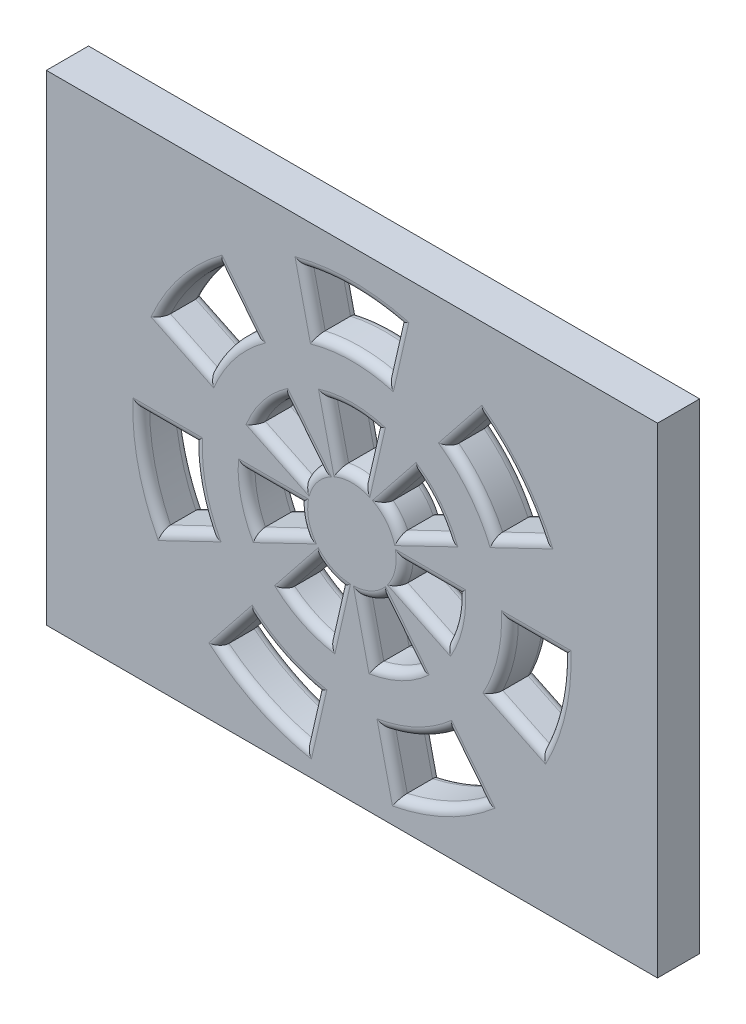
from build123d import *

# Parameters (mm, degrees)
BOSS_EXTRUDE1_DEPTH             = 2
BOSS_EXTRUDE2_DEPTH             = 38
SKETCH3_W                       = 1.9999999999999982
SKETCH3_H                       = 2
BOSS_EXTRUDE3_DEPTH             = 38
BOSS_EXTRUDE4_DEPTH             = 151
SKETCH6_W                       = 35.000000000000014
SKETCH6_H                       = 2.200000000000003
CUT_EXTRUDE1_DEPTH              = 160.34004518638747
SKETCH7_W                       = 35.00000000000001
SKETCH7_H                       = 2.200000000000003
CUT_EXTRUDE2_DEPTH              = 89.49011244201242
SKETCH5_W                       = 31.00000000000001
SKETCH5_H                       = 2
BOSS_EXTRUDE5_DEPTH             = 2
BOSS_EXTRUDE6_REACH             = 91.367
BOSS_EXTRUDE6_DIRECTION_2_REACH = 91.367
SKETCH10_W                      = 2
SKETCH10_H                      = 2.200000000000003
SKETCH10_W_2                    = 2.200000000000003
SKETCH10_H_2                    = 2
BOSS_EXTRUDE8_DEPTH             = 2
SKETCH11_W                      = 2
SKETCH11_H                      = 2.200000000000003
SKETCH11_W_2                    = 2.200000000000003
SKETCH11_H_2                    = 2
BOSS_EXTRUDE9_DEPTH             = 2
FILLET2_R                       = 2.5
SKETCH14_W                      = 36.5
SKETCH14_H                      = 7.750000000000002
BOSS_EXTRUDE10_DEPTH            = 2
SKETCH13_W                      = 31.000000000000007
SKETCH13_H                      = 3.000000000000001
CUT_EXTRUDE4_DEPTH              = 2
FILLET3_R                       = 2
FILLET4_R                       = 0.5
SKETCH15_R                      = 5.1000000000000005
CUT_EXTRUDE5_DEPTH              = 90.36721994109473
SKETCH16_R                      = 7.1000000000000005
BOSS_EXTRUDE11_DEPTH            = 1
FILLET5_R                       = 0.5
CUT_EXTRUDE3_DEPTH              = 160.34004518638747
FILLET6_R                       = 0.4
FILLET7_R                       = 0.5
CUT_EXTRUDE6_DEPTH              = 6
CUT_EXTRUDE8_DEPTH              = 90.367220028037
CUT_EXTRUDE11_DEPTH             = 90.367220028037
CUT_EXTRUDE11_DEPTH_BACK        = 90.367220028037
CUT_EXTRUDE12_DEPTH             = 43.59401366860162
CUT_EXTRUDE12_DEPTH_BACK        = 43.59401366860162
SKETCH21_W                      = 29
SKETCH21_H                      = 8.200000000000024


with BuildPart() as part:
    # Sketch1 → Boss-Extrude1 (new body)
    with BuildSketch(Plane(origin=(0, 0, 0), x_dir=(1, 0, 0), z_dir=(0, 1, 0))):
        Polygon((-19.500000000000007, 77.5), (19.499999999999993, 77.5), (19.50000000000001, -77.5), (-19.499999999999986, -77.5), align=None)
    extrude(amount=BOSS_EXTRUDE1_DEPTH)

    # Sketch2 → Boss-Extrude2 (add)
    with BuildSketch(Plane(origin=(0, 2, 0), x_dir=(1, 0, 0), z_dir=(0, 1, 0))):
        Polygon((-17.500000000000007, -77.5), (-17.500000000000007, -75.49999999999996), (-17.500000000000007, 75.5), (17.5, 75.5), (17.5, -75.49999999999994), (17.5, -77.5), (19.500000000000007, -77.5), (19.49999999999999, 77.5), (-19.500000000000007, 77.5), (-19.500000000000007, -77.5), align=None)
    extrude(amount=BOSS_EXTRUDE2_DEPTH)

    # Sketch3 → Boss-Extrude3 (add)
    with BuildSketch(Plane(origin=(0, 2, 0), x_dir=(1, 0, 0), z_dir=(0, 1, 0))):
        with Locations((-16.500000000000007, -76.5)):
            Rectangle(SKETCH3_W, SKETCH3_H)
        with Locations((-16.500000000000007, -72.3)):
            Rectangle(SKETCH3_W, SKETCH3_H)
        with Locations((16.5, -76.5)):
            Rectangle(SKETCH3_W, SKETCH3_H)
        with Locations((16.5, -72.3)):
            Rectangle(SKETCH3_W, SKETCH3_H)
    extrude(amount=BOSS_EXTRUDE3_DEPTH)

    # Sketch4 → Boss-Extrude4 (add)
    with BuildSketch(Plane.XY.offset(-75.5)):
        Polygon((-17.500000000000007, 40), (-15.500000000000009, 40), (-15.500000000000005, 38), (-17.500000000000007, 38), align=None)
        Polygon((-15.500000000000007, 33.8), (-17.500000000000007, 31.799999999999976), (-17.500000000000007, 35.8), (-15.500000000000005, 35.8), align=None)
        Polygon((15.500000000000005, 35.8), (17.500000000000007, 35.8), (17.500000000000007, 31.799999999999976), (15.500000000000007, 33.8), align=None)
        Polygon((17.500000000000007, 38), (17.5, 40), (15.500000000000009, 40), (15.500000000000005, 38), align=None)
    extrude(amount=BOSS_EXTRUDE4_DEPTH)

    # Sketch6 → Cut-Extrude1 (cut, through all)
    with BuildSketch(Plane.XY.offset(-75.5)):
        with Locations((0, 36.9)):
            Rectangle(SKETCH6_W, SKETCH6_H)
    extrude(amount=CUT_EXTRUDE1_DEPTH, mode=Mode.SUBTRACT)

    # Sketch7 → Cut-Extrude2 (cut, through all)
    with BuildSketch(Plane(origin=(0, 2, 0), x_dir=(1, 0, 0), z_dir=(0, 1, 0))):
        with Locations((-3.55e-15, -74.4)):
            Rectangle(SKETCH7_W, SKETCH7_H)
    extrude(amount=CUT_EXTRUDE2_DEPTH, mode=Mode.SUBTRACT)

    # Sketch5 → Boss-Extrude5 (add)
    with BuildSketch(Plane(origin=(0, 2, 0), x_dir=(1, 0, 0), z_dir=(0, 1, 0))):
        with Locations((-3.55e-15, -76.5)):
            Rectangle(SKETCH5_W, SKETCH5_H)
        Polygon((-15.500000000000009, -71.3), (15.500000000000002, -71.3), (15.5, -73.3), (-15.500000000000007, -73.3), align=None)
    extrude(amount=BOSS_EXTRUDE5_DEPTH)

    # Boss-Extrude6: up to this face of the body (flat: up to its plane)
    boss_extrude6_end = Plane(part.part.faces().sort_by_distance((17.5, 16.9, -2.1))[0])
    # Sketch8 → Boss-Extrude6 (add, up to the picked face)
    with BuildSketch(Plane(origin=(0, 0, 0), x_dir=(0, 0, -1), z_dir=(1, 0, 0)), mode=Mode.PRIVATE) as boss_extrude6_sk1:
        Polygon((75.5, 40), (73.5, 39.99999999999999), (73.49999999999999, 38), (75.5, 38), align=None)
    boss_extrude6_tool1 = split(extrude(boss_extrude6_sk1.sketch, amount=BOSS_EXTRUDE6_REACH, mode=Mode.PRIVATE), bisect_by=boss_extrude6_end, keep=Keep.BOTH, mode=Mode.PRIVATE)
    # Sketch8 → Boss-Extrude6 (add, up to the picked face)
    with BuildSketch(Plane(origin=(0, 0, 0), x_dir=(0, 0, -1), z_dir=(1, 0, 0)), mode=Mode.PRIVATE) as boss_extrude6_sk2:
        Polygon((75.5, 35.8), (73.5, 35.8), (73.49999999999999, 33.8), (75.5, 31.799999999999976), align=None)
    boss_extrude6_tool2 = split(extrude(boss_extrude6_sk2.sketch, amount=BOSS_EXTRUDE6_REACH, mode=Mode.PRIVATE), bisect_by=boss_extrude6_end, keep=Keep.BOTH, mode=Mode.PRIVATE)
    add(boss_extrude6_tool1.solids().sort_by(Axis((0, 39, -74.5), (1, 0, 0)))[0])
    add(boss_extrude6_tool2.solids().sort_by(Axis((0, 34.244444, -74.611111), (1, 0, 0)))[0])

    # Boss-Extrude6 direction 2: up to this face of the body (flat: up to its plane)
    boss_extrude6_direction_2_end = Plane(part.part.faces().sort_by_distance((-17.5, 16.9, -2.1))[0])
    # Sketch8 → Boss-Extrude6 direction 2 (add, up to the picked face)
    with BuildSketch(Plane(origin=(0, 0, 0), x_dir=(0, 0, -1), z_dir=(1, 0, 0)), mode=Mode.PRIVATE) as boss_extrude6_direction_2_sk1:
        Polygon((75.5, 40), (73.5, 39.99999999999999), (73.49999999999999, 38), (75.5, 38), align=None)
    boss_extrude6_direction_2_tool1 = split(extrude(boss_extrude6_direction_2_sk1.sketch, amount=-BOSS_EXTRUDE6_DIRECTION_2_REACH, mode=Mode.PRIVATE), bisect_by=boss_extrude6_direction_2_end, keep=Keep.BOTH, mode=Mode.PRIVATE)
    # Sketch8 → Boss-Extrude6 direction 2 (add, up to the picked face)
    with BuildSketch(Plane(origin=(0, 0, 0), x_dir=(0, 0, -1), z_dir=(1, 0, 0)), mode=Mode.PRIVATE) as boss_extrude6_direction_2_sk2:
        Polygon((75.5, 35.8), (73.5, 35.8), (73.49999999999999, 33.8), (75.5, 31.799999999999976), align=None)
    boss_extrude6_direction_2_tool2 = split(extrude(boss_extrude6_direction_2_sk2.sketch, amount=-BOSS_EXTRUDE6_DIRECTION_2_REACH, mode=Mode.PRIVATE), bisect_by=boss_extrude6_direction_2_end, keep=Keep.BOTH, mode=Mode.PRIVATE)
    add(boss_extrude6_direction_2_tool1.solids().sort_by(Axis((0, 39, -74.5), (-1, 0, 0)))[0])
    add(boss_extrude6_direction_2_tool2.solids().sort_by(Axis((0, 34.244444, -74.611111), (-1, 0, 0)))[0])

    # Sketch10 → Boss-Extrude8 (add)
    with BuildSketch(Plane(origin=(-17.500000000000007, 0, 0), x_dir=(0, 0, -1), z_dir=(1, 0, 0))):
        with Locations((-76.5, 36.9)):
            Rectangle(SKETCH10_W, SKETCH10_H)
        with Locations((-74.4, 39)):
            Rectangle(SKETCH10_W_2, SKETCH10_H_2)
    extrude(amount=BOSS_EXTRUDE8_DEPTH)

    # Sketch11 → Boss-Extrude9 (add)
    with BuildSketch(Plane.ZY.offset(-17.5)):
        with Locations((76.5, 36.9)):
            Rectangle(SKETCH11_W, SKETCH11_H)
        with Locations((74.4, 39)):
            Rectangle(SKETCH11_W_2, SKETCH11_H_2)
    extrude(amount=BOSS_EXTRUDE9_DEPTH)

    # Fillet2
    fillet2_edges = [part.edges().sort_by_distance(p)[0] for p in [
        (-17.500000000000007, 16.899999999999988, 71.3),
        (17.5, 16.899999999999988, 71.3),
        (19.500000000000007, 20, 77.5),
        (-19.499999999999996, 20, 77.5),
        (-19.500000000000007, 20, -77.5),
        (-17.500000000000007, 16.899999999999988, -75.5),
        (17.5, 16.899999999999988, -75.5),
        (19.499999999999993, 20, -77.5),
        (19.5, 40, 0),
        (-19.500000000000007, 40, 0),
        (19.5, 0, 0),
        (-19.499999999999996, 0, 0),
        (-7.11e-15, 40, -77.5),
        (1.066e-14, 0, 77.5),
        (-7.11e-15, 0, -77.5),
        (-17.500000000000007, 40, 77.5),
        (17.500000000000004, 40, 77.5),
    ]]
    fillet(fillet2_edges, radius=FILLET2_R)

    # Sketch14 → Boss-Extrude10 (add)
    with BuildSketch(Plane.XY.offset(-75.5)):
        with Locations((8.88e-15, 5.125000000000001)):
            Rectangle(SKETCH14_W, SKETCH14_H)
    extrude(amount=BOSS_EXTRUDE10_DEPTH)

    # Sketch13 → Cut-Extrude4 (cut)
    with BuildSketch(Plane(origin=(0, 0, -77.5), x_dir=(-1, 0, 0), z_dir=(0, 0, -1))):
        with Locations((2.66e-15, 5.5)):
            Rectangle(SKETCH13_W, SKETCH13_H)
    extrude(amount=-CUT_EXTRUDE4_DEPTH, mode=Mode.SUBTRACT)

    # Fillet3
    fillet3_edges = [part.edges().sort_by_distance(p)[0] for p in [
        (-8.527e-14, 9.000000000000002, -73.5),
    ]]
    fillet(fillet3_edges, radius=FILLET3_R - 0.0001)  # a hair under: the kernel refuses the full size

    # Fillet4
    fillet4_edges = [part.edges().sort_by_distance(p)[0] for p in [
        (15.5, 5.5, -75.5),
        (15.5, 4, -76.5),
        (-3.55e-15, 7, -75.5),
        (15.5, 7, -76.5),
        (-15.500000000000007, 5.5, -75.5),
        (-15.500000000000007, 7, -76.5),
        (-3.55e-15, 4, -75.5),
        (-15.500000000000007, 4, -76.5),
        (15.5, 5.5, -77.5),
        (-3.55e-15, 4, -77.5),
        (-15.500000000000007, 5.5, -77.5),
        (-3.55e-15, 7, -77.5),
    ]]
    fillet(fillet4_edges, radius=FILLET4_R)

    # Sketch15 → Cut-Extrude5 (cut, through all)
    with BuildSketch(Plane.XZ):
        with Locations(Location((6.94e-15, 38.75, 0), (0, 0, 270))):
            Circle(SKETCH15_R)
        with Locations(Location((-1.73e-15, -38.75, 0), (0, 0, 270))):
            Circle(SKETCH15_R)
    extrude(amount=-CUT_EXTRUDE5_DEPTH, mode=Mode.SUBTRACT)

    # Sketch16 → Boss-Extrude11 (add)
    with BuildSketch(Plane(origin=(0, 2, 0), x_dir=(1, 0, 0), z_dir=(0, 1, 0))):
        with Locations(Location((-1.73e-15, 38.75, 0), (0, 0, 270))):
            Circle(SKETCH16_R)
        with Locations(Location((6.94e-15, -38.75, 0), (0, 0, 270))):
            Circle(SKETCH16_R)
    extrude(amount=BOSS_EXTRUDE11_DEPTH)

    # Fillet5
    fillet5_edges = [part.edges().sort_by_distance(p)[0] for p in [
        (4.4e-16, 2, -45.85),
        (4.4e-16, 3, -45.85),
        (9.11e-15, 2, 31.65),
        (9.11e-15, 3, 31.65),
    ]]
    fillet(fillet5_edges, radius=FILLET5_R - 0.0001)  # a hair under: the kernel refuses the full size

    # Sketch12 → Cut-Extrude3 (cut, through all)
    with BuildSketch(Plane.XY.offset(-75.5)):
        with BuildLine():
            Line((1.6689070046723542, 12.688040658636323), (2.2252093395631403, 10.250720878181761))
            ThreePointArc((2.2252093395631407, 10.250720878181761), (4.338837391175579, 10.990311320975806), (6.234898018587327, 12.181685175319693))
            Line((6.234898018587329, 12.181685175319691), (4.676173513940492, 14.136263881489775))
            ThreePointArc((4.676173513940316, 14.13626388148963), (3.254128043381647, 13.242733490731839), (1.6689070046724976, 12.688040658636355))
        make_face()
        with BuildLine():
            ThreePointArc((-6.23489801858734, 12.181685175319702), (-4.338837391175585, 10.990311320975808), (-2.2252093395631483, 10.250720878181761))
            Line((-2.2252093395631474, 10.250720878181763), (-1.6689070046723613, 12.688040658636321))
            ThreePointArc((-1.668907004672504, 12.688040658636357), (-3.2541280433816526, 13.24273349073184), (-4.676173513940327, 14.136263881489636))
            Line((-4.676173513940502, 14.136263881489779), (-6.234898018587339, 12.1816851753197))
        make_face()
        with BuildLine():
            ThreePointArc((-10.000000000000004, 20), (-9.749279121818198, 17.774790660436675), (-9.009688679024032, 15.661162608824078))
            Line((-9.009688679024112, 15.66116260882404), (-6.75726650926802, 16.74587195661806))
            ThreePointArc((-6.757266509268129, 16.74587195661828), (-7.311959341363676, 18.331092995327626), (-7.500000000000002, 20))
            Line((-7.500000000000002, 20), (-10.000000000000004, 20))
        make_face()
        with BuildLine():
            ThreePointArc((-6.234898018587335, 27.818314824680304), (-7.818314824680224, 26.234898018587437), (-9.00968867902409, 24.3388373911758))
            Line((-9.009688679024169, 24.338837391175833), (-6.75726650926807, 23.254128043381847))
            ThreePointArc((-6.757266509268174, 23.254128043381627), (-5.863736118510171, 24.67617351394057), (-4.6761735139403156, 25.863736118510374))
            Line((-4.676173513940501, 25.86373611851023), (-6.234898018587329, 27.818314824680296))
        make_face()
        with BuildLine():
            ThreePointArc((-1.6689070046724956, 27.311959341363647), (-0.8397335707748118, 27.45284157419932), (1.3528e-13, 27.5))
            Line((-2.39e-15, 27.5), (-2.6e-15, 30))
            ThreePointArc((-3.5639e-13, 30), (-1.1196447610332543, 29.937122098932406), (-2.225209339563141, 29.74927912181824))
            Line((-2.2252093395631403, 29.749279121818233), (-1.6689070046723562, 27.31195934136368))
        make_face()
        with BuildLine():
            Line((-2.6e-15, 30), (-2.39e-15, 27.5))
            ThreePointArc((1.3528e-13, 27.5), (0.8397335707749499, 27.452841574199304), (1.6689070046725027, 27.311959341363643))
            Line((1.6689070046723624, 27.311959341363675), (2.225209339563151, 29.749279121818233))
            ThreePointArc((2.225209339563152, 29.749279121818233), (1.1196447610329054, 29.93712209893245), (-3.5639e-13, 30))
        make_face()
        with BuildLine():
            Line((6.757266509268147, 23.254128043381684), (9.009688679024192, 24.338837391175574))
            ThreePointArc((9.009688679024194, 24.338837391175574), (7.818314824680302, 26.23489801858733), (6.23489801858734, 27.818314824680293))
            Line((6.234898018587339, 27.818314824680293), (4.676173513940503, 25.863736118510218))
            ThreePointArc((4.67617351394032, 25.863736118510367), (5.863736118510228, 24.676173513940494), (6.757266509268249, 23.254128043381463))
        make_face()
        with BuildLine():
            Line((6.757266509268139, 16.745871956618306), (9.009688679024189, 15.661162608824407))
            ThreePointArc((9.009688679024185, 15.661162608824409), (9.749279121818235, 17.774790660436853), (10, 19.999999999999996))
            Line((10, 19.999999999999993), (7.499999999999998, 19.999999999999996))
            ThreePointArc((7.499999999999998, 19.999999999999996), (7.311959341363702, 18.331092995327758), (6.757266509268241, 16.745871956618522))
        make_face()
        with BuildLine():
            ThreePointArc((2.4999999999999973, 20), (2.437319780454564, 19.443697665109248), (2.252422169756075, 18.915290652206167))
            Line((2.252422169756045, 18.915290652206103), (4.504844339512091, 17.830581304412206))
            ThreePointArc((4.504844339512107, 17.830581304412235), (4.87463956090912, 18.887395330218443), (4.999999999999998, 20))
            Line((4.999999999999998, 19.999999999999996), (2.4999999999999973, 20))
        make_face()
        with BuildLine():
            ThreePointArc((1.558724504646812, 21.95457870617009), (1.954578706170087, 21.558724504646815), (2.252422169756077, 21.08470934779383))
            Line((2.2524221697560476, 21.084709347793893), (4.504844339512096, 22.169418695587787))
            ThreePointArc((4.504844339512113, 22.16941869558775), (3.909157412340132, 23.117449009293686), (3.1174490092935923, 23.909157412340207))
            Line((3.1174490092936673, 23.909157412340143), (1.5587245046468325, 21.95457870617007))
        make_face()
        with BuildLine():
            Line((-2.17e-15, 25), (-1.95e-15, 22.5))
            ThreePointArc((4.338e-14, 22.5), (0.27991119025833583, 22.484280524733098), (0.5563023348908734, 22.437319780454537))
            Line((0.5563023348907861, 22.43731978045456), (1.1126046697815741, 24.874639560909117))
            ThreePointArc((1.1126046697816625, 24.874639560909095), (0.5598223805166195, 24.968561049466203), (6.852e-14, 25))
        make_face()
        with BuildLine():
            ThreePointArc((-0.556302334890874, 22.437319780454537), (-0.27991119025829314, 22.4842805247331), (4.338e-14, 22.5))
            Line((-1.95e-15, 22.5), (-2.17e-15, 25))
            ThreePointArc((6.852e-14, 25), (-0.5598223805165496, 24.96856104946621), (-1.11260466978166, 24.8746395609091))
            Line((-1.1126046697815706, 24.874639560909117), (-0.5563023348907861, 22.43731978045456))
        make_face()
        with BuildLine():
            ThreePointArc((-2.2524221697560542, 21.084709347793883), (-1.9545787061700715, 21.55872450464684), (-1.5587245046468132, 21.954578706170093))
            Line((-1.558724504646833, 21.954578706170075), (-3.1174490092936686, 23.909157412340154))
            ThreePointArc((-3.117449009293589, 23.909157412340214), (-3.9091574123400923, 23.11744900929374), (-4.504844339512061, 22.169418695587865))
            Line((-4.504844339512046, 22.169418695587897), (-2.252422169756023, 21.084709347793947))
        make_face()
        with BuildLine():
            ThreePointArc((-2.2524221697560396, 18.915290652206085), (-2.4373197804545574, 19.443697665109205), (-2.500000000000001, 20))
            Line((-2.500000000000001, 20), (-5.000000000000002, 20))
            ThreePointArc((-5.000000000000002, 20), (-4.874639560909102, 18.887395330218354), (-4.50484433951203, 17.83058130441207))
            Line((-4.5048443395120135, 17.83058130441204), (-2.2524221697560076, 18.91529065220602))
        make_face()
        with BuildLine():
            ThreePointArc((-3.1174490092937464, 16.090842587659914), (-2.169418695587877, 15.495155660487946), (-1.1126046697816612, 15.125360439090901))
            Line((-1.112604669781575, 15.12536043909088), (-0.5563023348907877, 17.56268021954544))
            ThreePointArc((-0.5563023348908746, 17.562680219545463), (-1.0847093477939251, 17.747577830243966), (-1.5587245046468128, 18.045421293829907))
            Line((-1.5587245046468328, 18.04542129382993), (-3.1174490092936677, 16.090842587659854))
        make_face()
        with BuildLine():
            Line((0.5563023348907832, 17.56268021954544), (1.1126046697815692, 15.12536043909088))
            ThreePointArc((1.112604669781656, 15.125360439090901), (2.169418695587868, 15.495155660487942), (3.1174490092937344, 16.090842587659907))
            Line((3.1174490092936615, 16.09084258765985), (1.558724504646829, 18.045421293829925))
            ThreePointArc((1.5587245046468068, 18.045421293829907), (1.0847093477939187, 17.747577830243966), (0.5563023348908702, 17.562680219545463))
        make_face()
    extrude(amount=-CUT_EXTRUDE3_DEPTH, mode=Mode.SUBTRACT)

    # Fillet6
    fillet6_edges = [part.edges().sort_by_distance(p)[0] for p in [
        (5.863736118510229, 24.676173513940494, -75.5),
        (5.455535766263921, 26.841025471595255, -75.5),
        (7.818314824680302, 26.23489801858733, -77.5),
        (7.883477594146171, 23.79648271727863, -77.5),
        (5.863736118510229, 24.676173513940494, -77.5),
        (5.455535766263922, 26.84102547159526, -77.5),
        (7.88347759414617, 23.79648271727863, -75.5),
        (7.818314824680301, 26.23489801858733, -75.5),
        (7.3119593413637, 18.331092995327754, -75.5),
        (8.75, 19.999999999999993, -75.5),
        (9.749279121818237, 17.77479066043685, -77.5),
        (7.883477594146164, 16.203517282721357, -77.5),
        (7.3119593413637, 18.33109299532775, -77.5),
        (8.749999999999998, 19.999999999999996, -77.5),
        (7.883477594146164, 16.203517282721357, -75.5),
        (9.749279121818237, 17.77479066043685, -75.5),
        (2.4373197804545637, 19.443697665109248, -75.5),
        (3.749999999999998, 20, -75.5),
        (4.87463956090912, 18.887395330218443, -77.5),
        (3.378633254634069, 18.372935978309155, -77.5),
        (2.4373197804545637, 19.443697665109248, -77.5),
        (3.749999999999999, 20, -77.5),
        (3.378633254634068, 18.372935978309155, -75.5),
        (4.87463956090912, 18.887395330218443, -75.5),
        (1.954578706170087, 21.558724504646815, -75.5),
        (2.3380867569702497, 22.93186805925511, -75.5),
        (3.9091574123401314, 23.117449009293686, -77.5),
        (3.378633254634069, 21.627064021690842, -77.5),
        (1.9545787061700866, 21.558724504646815, -77.5),
        (2.3380867569702497, 22.93186805925511, -77.5),
        (3.378633254634072, 21.627064021690842, -75.5),
        (3.9091574123401314, 23.117449009293686, -75.5),
        (3.61e-15, 27.5, -75.5),
        (-1.9470581721177482, 28.530619231590954, -75.5),
        (-3.42e-14, 30, -77.5),
        (1.9470581721177582, 28.530619231590954, -77.5),
        (2.648e-14, 27.5, -77.5),
        (-1.9470581721177453, 28.530619231590958, -77.5),
        (1.9470581721177567, 28.530619231590954, -75.5),
        (6.11e-15, 30, -75.5),
        (-5.863736118510172, 24.67617351394057, -75.5),
        (-7.88347759414612, 23.796482717278842, -75.5),
        (-7.818314824680227, 26.234898018587437, -77.5),
        (-5.455535766263916, 26.841025471595266, -77.5),
        (-5.863736118510172, 24.67617351394057, -77.5),
        (-7.883477594146118, 23.796482717278842, -77.5),
        (-5.455535766263916, 26.841025471595263, -75.5),
        (-7.818314824680227, 26.234898018587437, -75.5),
        (-7.311959341363675, 18.331092995327623, -75.5),
        (-7.883477594146067, 16.20351728272105, -75.5),
        (-9.749279121818194, 17.774790660436672, -77.5),
        (-8.750000000000004, 20, -77.5),
        (-7.311959341363675, 18.331092995327626, -77.5),
        (-7.883477594146067, 16.20351728272105, -77.5),
        (-8.750000000000004, 20, -75.5),
        (-9.749279121818194, 17.774790660436672, -75.5),
        (-3.254128043381653, 13.24273349073184, -75.5),
        (-1.9470581721177544, 11.469380768409042, -75.5),
        (-4.338837391175585, 10.990311320975808, -77.5),
        (-5.455535766263919, 13.15897452840474, -77.5),
        (-3.2541280433816566, 13.242733490731842, -77.5),
        (-1.9470581721177538, 11.469380768409042, -77.5),
        (-5.455535766263921, 13.15897452840474, -75.5),
        (-4.338837391175585, 10.990311320975808, -75.5),
        (1.0847093477939187, 17.747577830243966, -75.5),
        (2.3380867569702453, 17.068131940744887, -75.5),
        (2.169418695587869, 15.495155660487942, -77.5),
        (0.834453502336179, 16.344020329318163, -77.5),
        (1.0847093477939183, 17.747577830243966, -77.5),
        (2.3380867569702444, 17.068131940744887, -77.5),
        (0.8344535023361762, 16.344020329318163, -75.5),
        (2.169418695587869, 15.495155660487942, -75.5),
        (-2.437319780454557, 19.443697665109205, -75.5),
        (-3.3786332546340105, 18.37293597830903, -75.5),
        (-4.874639560909101, 18.887395330218354, -77.5),
        (-3.75, 20, -77.5),
        (-2.4373197804545574, 19.443697665109205, -77.5),
        (-3.3786332546340105, 18.37293597830903, -77.5),
        (-3.7500000000000013, 20, -75.5),
        (-4.874639560909101, 18.887395330218354, -75.5),
        (-1.0847093477939243, 17.747577830243966, -75.5),
        (-0.8344535023361814, 16.344020329318163, -75.5),
        (-2.1694186955878774, 15.495155660487946, -77.5),
        (-2.338086756970248, 17.06813194074489, -77.5),
        (-1.0847093477939245, 17.747577830243966, -77.5),
        (-0.8344535023361823, 16.34402032931816, -77.5),
        (-2.33808675697025, 17.06813194074489, -75.5),
        (-2.1694186955878774, 15.495155660487946, -75.5),
        (-1.9545787061700717, 21.55872450464684, -75.5),
        (-3.3786332546340345, 21.62706402169092, -75.5),
        (-3.9091574123400923, 23.11744900929374, -77.5),
        (-2.3380867569702497, 22.931868059255116, -77.5),
        (-1.9545787061700715, 21.55872450464684, -77.5),
        (-3.3786332546340345, 21.627064021690924, -77.5),
        (-2.3380867569702506, 22.931868059255116, -75.5),
        (-3.9091574123400923, 23.11744900929374, -75.5),
        (-2.44e-15, 25, -77.5),
        (0.8344535023361805, 23.655979670681837, -77.5),
        (7.2e-16, 22.5, -75.5),
        (-0.8344535023361783, 23.655979670681837, -75.5),
        (4.03e-15, 22.5, -77.5),
        (-0.8344535023361774, 23.655979670681837, -77.5),
        (3e-15, 25, -75.5),
        (0.8344535023361801, 23.655979670681837, -75.5),
        (3.2541280433816433, 13.242733490731837, -75.5),
        (5.45553576626391, 13.158974528404734, -75.5),
        (4.338837391175575, 10.990311320975803, -77.5),
        (1.9470581721177505, 11.469380768409042, -77.5),
        (3.254128043381639, 13.242733490731835, -77.5),
        (5.455535766263912, 13.158974528404734, -77.5),
        (1.9470581721177473, 11.469380768409042, -75.5),
        (4.338837391175575, 10.990311320975803, -75.5),
    ]]
    fillet(fillet6_edges, radius=FILLET6_R)

    # Fillet7
    fillet7_edges = [part.edges().sort_by_distance(p)[0] for p in [
        (15.500000000000005, 40, 0.75),
        (-5.33e-15, 4, 77.5),
        (0, 40, -73.5),
        (-15.500000000000009, 40, 0.75),
        (-15.500000000000009, 20.75, 77.5),
        (-15.500000000000009, 39.26776695296637, 76.76776695296637),
        (15.5, 20.75, 77.5),
        (15.5, 39.26776695296637, 76.76776695296637),
    ]]
    fillet(fillet7_edges, radius=FILLET7_R)

    # Sketch17 → Cut-Extrude6 (cut)
    with BuildSketch(Plane.XZ):
        Polygon((-16.99999999999998, -77.5), (-16.999999999999986, 70.29999999888179), (-14.999999998881872, 71.29999999999998), (-14.999999998881872, 77.5), (14.9999999988819, 77.5), (14.9999999988819, 71.29999999999998), (16.999999999999993, 70.29999999888177), (16.999999999999996, -77.5), align=None)
    extrude(amount=-CUT_EXTRUDE6_DEPTH, mode=Mode.SUBTRACT)

    # Sketch18 → Cut-Extrude8 (cut, through all)
    with BuildSketch(Plane.XY):
        Polygon((-14.5, 9.000000000000002), (14.5, 9.000000000000005), (14.5, 6.0000000000000036), (-14.5, 6), align=None)
    extrude(amount=-CUT_EXTRUDE8_DEPTH, mode=Mode.SUBTRACT)

    # Sketch20 → Cut-Extrude11 (cut, two sides: drawn at the far end of the back side and taken through both)
    with BuildSketch(Plane.XY.offset(-CUT_EXTRUDE11_DEPTH_BACK)):
        Polygon((19.50000000000001, 40), (14.5, 40), (14.5, 6.0000000000000036), (14.500000000000005, 0), (19.500000000000018, 0), align=None)
        Polygon((-19.499999999999986, 40), (-14.5, 40), (-14.499999999999995, 0), (-19.499999999999982, 0), align=None)
    extrude(amount=CUT_EXTRUDE11_DEPTH + CUT_EXTRUDE11_DEPTH_BACK, mode=Mode.SUBTRACT)

    # Sketch21 → Cut-Extrude12 (cut, two sides: drawn at the far end of the back side and taken through both)
    with BuildSketch(Plane.XY.offset(-75.5).offset(-CUT_EXTRUDE12_DEPTH_BACK)):
        with Locations((1.78e-15, 35.89999999999999)):
            Rectangle(SKETCH21_W, SKETCH21_H)
    extrude(amount=CUT_EXTRUDE12_DEPTH + CUT_EXTRUDE12_DEPTH_BACK, mode=Mode.SUBTRACT)


solid = part.part
